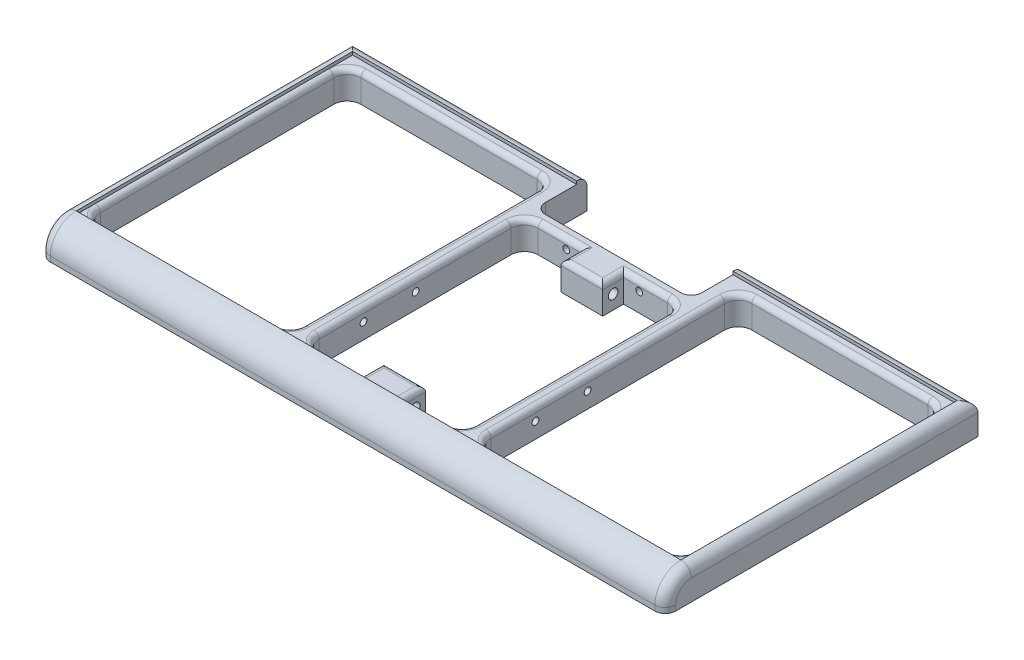
from build123d import *

# Parameters (mm, degrees)
SKETCH1_W           = 600
SKETCH1_H           = 300
BOSS_EXTRUDE1_DEPTH = 30
CUT_EXTRUDE1_DEPTH  = 672.490878568
FILLET1_R           = 25
FILLET2_R           = 10
SKETCH3_W           = 195
SKETCH3_H           = 250
CUT_EXTRUDE2_DEPTH  = 672.490878568
SKETCH4_R           = 3.25
CUT_EXTRUDE3_DEPTH  = 200
CUT_EXTRUDE4_DEPTH  = 3
SKETCH7_R           = 4.66700581
CUT_EXTRUDE5_DEPTH  = 53
SKETCH8_R           = 3.25
CUT_EXTRUDE6_DEPTH  = 53
FILLET3_R           = 13
FILLET4_R           = 5


with BuildPart() as part:
    # Sketch1 → Boss-Extrude1 (new body)
    with BuildSketch(Plane(origin=(0, 0, 0), x_dir=(1, 0, 0), z_dir=(0, 1, 0))):
        with Locations((300, 150)):
            Rectangle(SKETCH1_W, SKETCH1_H)
    extrude(amount=BOSS_EXTRUDE1_DEPTH)

    # Sketch2 → Cut-Extrude1 (cut, through all)
    with BuildSketch(Plane(origin=(0, 30, 0), x_dir=(1, 0, 0), z_dir=(0, 1, 0))):
        with BuildLine():
            Line((225, 350), (375, 350))
            Line((375, 350), (375, 260))
            ThreePointArc((375, 260), (372.071067812, 252.928932188), (365, 250))
            Line((365, 250), (235, 250))
            ThreePointArc((235, 250), (227.928932188, 252.928932188), (225, 260))
            Line((225, 260), (225, 350))
        make_face()
    extrude(amount=-CUT_EXTRUDE1_DEPTH, mode=Mode.SUBTRACT)

    # Fillet1
    fillet1_edges = [part.edges().sort_by_distance(p)[0] for p in [
        (300, 30, 0),
    ]]
    fillet(fillet1_edges, radius=FILLET1_R)

    # Fillet2
    fillet2_edges = [part.edges().sort_by_distance(p)[0] for p in [
        (487.5, 30, -300),
        (112.5, 30, -300),
        (600, 30, -162.5),
        (600, 2.5, 0),
        (600, 22.67766953, -7.32233047),
        (0, 2.5, 0),
        (0, 22.67766953, -7.32233047),
        (0, 30, -162.5),
    ]]
    fillet(fillet2_edges, radius=FILLET2_R)

    # Sketch3 → Cut-Extrude2 (cut, through all)
    with BuildSketch(Plane(origin=(0, 30, 0), x_dir=(1, 0, 0), z_dir=(0, 1, 0))):
        Polygon((280, 240), (280, 220), (320, 220), (320, 240), (375, 240), (375, 30), (320, 30), (320, 50), (280, 50), (280, 30), (225, 30), (225, 240), align=None)
        with Locations((112.5, 155)):
            Rectangle(SKETCH3_W, SKETCH3_H)
        with Locations((487.5, 155)):
            Rectangle(SKETCH3_W, SKETCH3_H)
    extrude(amount=-CUT_EXTRUDE2_DEPTH, mode=Mode.SUBTRACT)

    # Sketch4 → Cut-Extrude3 (cut)
    with BuildSketch(Plane.ZY.offset(-210)):
        with Locations((-135.475660035, 15)):
            Circle(SKETCH4_R)
        with Locations((-85.475660035, 15)):
            Circle(SKETCH4_R)
    extrude(amount=-CUT_EXTRUDE3_DEPTH, mode=Mode.SUBTRACT)

    # Sketch6 → Cut-Extrude4 (cut)
    with BuildSketch(Plane(origin=(0, 30, 0), x_dir=(1, 0, 0), z_dir=(0, 1, 0))):
        with BuildLine():
            Line((10, 25), (590, 25))
            Line((590, 25), (590, 290))
            Line((590, 290), (375, 290))
            Line((375, 290), (375, 260))
            ThreePointArc((375, 260), (372.071067812, 252.928932188), (365, 250))
            Line((365, 250), (235, 250))
            ThreePointArc((235, 250), (227.928932188, 252.928932188), (225, 260))
            Line((225, 260), (225, 290))
            Line((225, 290), (10, 290))
            Line((10, 290), (10, 25))
        make_face()
    extrude(amount=-CUT_EXTRUDE4_DEPTH, mode=Mode.SUBTRACT)

    # Sketch7 → Cut-Extrude5 (cut)
    with BuildSketch(Plane.ZY.offset(-280)):
        with Locations((-230, 13.5)):
            Circle(SKETCH7_R)
        with Locations((-40, 13.5)):
            Circle(SKETCH7_R)
    extrude(amount=-CUT_EXTRUDE5_DEPTH, mode=Mode.SUBTRACT)

    # Sketch8 → Cut-Extrude6 (cut)
    with BuildSketch(Plane(origin=(0, 0, -250), x_dir=(-1, 0, 0), z_dir=(0, 0, -1))):
        with Locations((-335, 18)):
            Circle(SKETCH8_R)
        with Locations((-265, 18)):
            Circle(SKETCH8_R)
    extrude(amount=-CUT_EXTRUDE6_DEPTH, mode=Mode.SUBTRACT)

    # Fillet3
    fillet3_edges = [part.edges().sort_by_distance(p)[0] for p in [
        (390, 13.5, -30),
        (390, 13.5, -280),
        (585, 13.5, -280),
        (585, 13.5, -30),
        (15, 13.5, -30),
        (15, 13.5, -280),
        (210, 13.5, -280),
        (210, 13.5, -30),
        (225, 13.5, -240),
        (375, 13.5, -240),
        (375, 13.5, -30),
        (225, 13.5, -30),
    ]]
    fillet(fillet3_edges, radius=FILLET3_R)

    # Fillet4
    fillet4_edges = [part.edges().sort_by_distance(p)[0] for p in [
        (280, 27, -230),
        (300, 27, -220),
        (320, 27, -230),
        (341, 27, -240),
        (320, 27, -40),
        (300, 27, -50),
        (280, 27, -40),
        (259, 27, -30),
        (375, 27, -135),
        (390, 27, -155),
        (487.5, 27, -280),
        (585, 27, -155),
        (487.5, 27, -30),
        (341, 27, -30),
        (225, 27, -135),
        (259, 27, -240),
        (210, 27, -155),
        (112.5, 27, -30),
        (15, 27, -155),
        (112.5, 27, -280),
        (371.192388155, 27, -236.192388155),
        (393.807611845, 27, -276.192388155),
        (581.192388155, 27, -276.192388155),
        (581.192388155, 27, -33.807611845),
        (393.807611845, 27, -33.807611845),
        (371.192388155, 27, -33.807611845),
        (228.807611845, 27, -236.192388155),
        (228.807611845, 27, -33.807611845),
        (206.192388155, 27, -33.807611845),
        (18.807611845, 27, -33.807611845),
        (18.807611845, 27, -276.192388155),
        (206.192388155, 27, -276.192388155),
    ]]
    fillet(fillet4_edges, radius=FILLET4_R - 0.0001)  # a hair under: the kernel refuses the full size


solid = part.part
